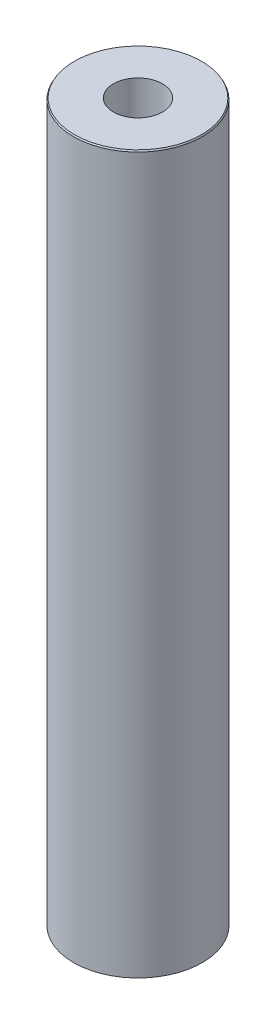
from build123d import *
from OCP.BRepFilletAPI import BRepFilletAPI_MakeChamfer

# Parameters (mm, degrees)
SKETCH1_R           = 40
BOSS_EXTRUDE1_DEPTH = 445.623488212
SKETCH2_R           = 15.231605012
CUT_EXTRUDE1_DEPTH  = 450.199614032
CHAMFER1_SIZE       = 0.870936123
CHAMFER1_SIZE2      = 0.502835205


with BuildPart() as part:
    # Sketch1 → Boss-Extrude1 (new body)
    with BuildSketch(Plane(origin=(0, 0, 0), x_dir=(1, 0, 0), z_dir=(0, 1, 0))):
        Circle(SKETCH1_R)
    extrude(amount=BOSS_EXTRUDE1_DEPTH)

    # Sketch2 → Cut-Extrude1 (cut, through all)
    with BuildSketch(Plane(origin=(0, 0, 0), x_dir=(1, 0, 0), z_dir=(0, 1, 0))):
        Circle(SKETCH2_R)
    extrude(amount=CUT_EXTRUDE1_DEPTH, mode=Mode.SUBTRACT)

    # Chamfer1: one chamfer whose edges measure the first distance from different faces: ONE call of the kernel's chamfer builder (chamfer() names one face for all edges)
    chamfer1_edges_1 = [part.edges().sort_by_distance(p)[0] for p in [
        (-40, 445.623488212, 0),
    ]]
    chamfer1_side_1 = [part.faces().sort_by_distance(p)[0] for p in [
        (-40, 222.811744106, 0),
    ]]
    chamfer1_edges_2 = [part.edges().sort_by_distance(p)[0] for p in [
        (-40, 0, 0),
    ]]
    chamfer1_side_2 = [part.faces().sort_by_distance(p)[0] for p in [
        (-38.86862915, 0, 0),
    ]]
    chamfer1 = BRepFilletAPI_MakeChamfer(part.part.solid().wrapped)
    for e in chamfer1_edges_1:
        chamfer1.Add(CHAMFER1_SIZE, CHAMFER1_SIZE2, e.wrapped, chamfer1_side_1[0].wrapped)  # the first distance lies on this face
    for e in chamfer1_edges_2:
        chamfer1.Add(CHAMFER1_SIZE, CHAMFER1_SIZE2, e.wrapped, chamfer1_side_2[0].wrapped)  # the first distance lies on this face
    add(Compound.cast(chamfer1.Shape()), mode=Mode.REPLACE)


solid = part.part
